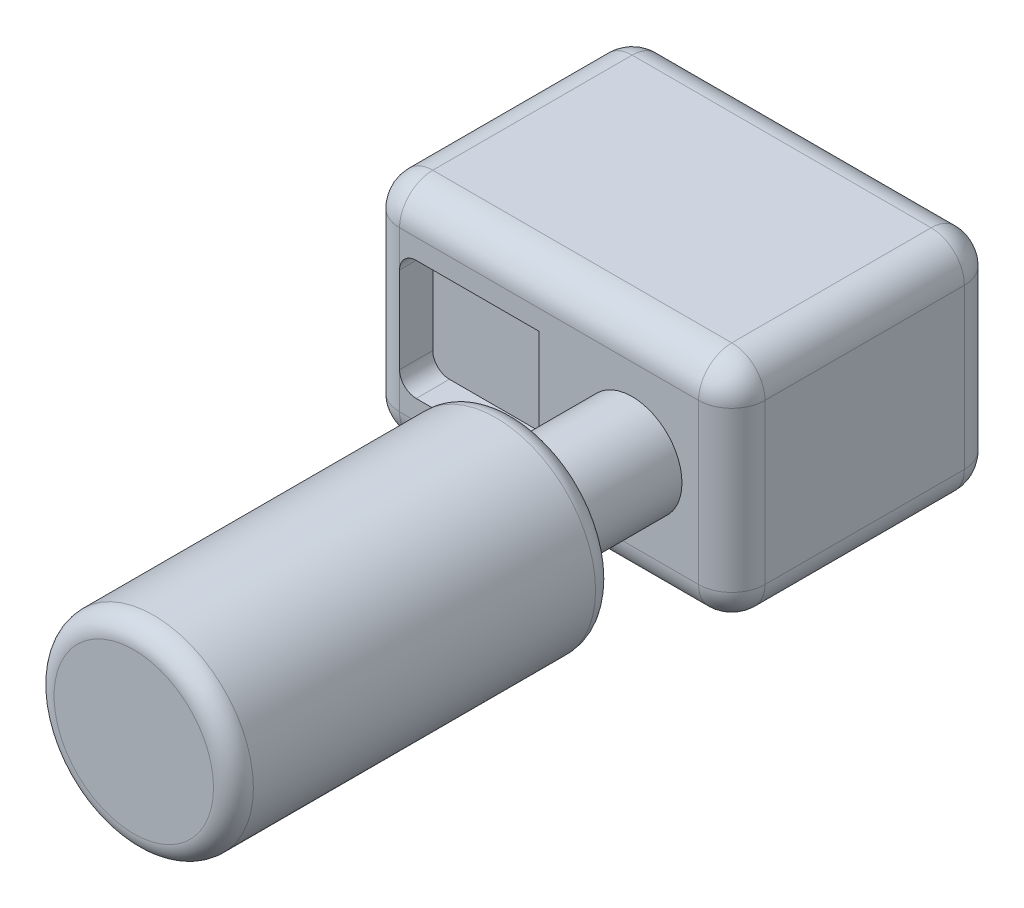
from build123d import *

# Parameters (mm, degrees)
ESQUISSE1_W             = 110
ESQUISSE1_H             = 68
BOSS_EXTRU_1_DEPTH      = 80
ESQUISSE2_R             = 30
BOSS_EXTRU_2_DEPTH      = 150
CONG_2_R                = 6
ESQUISSE8_R             = 30
ESQUISSE8_R_2           = 15
ENL_V_MAT_EXTRU_1_DEPTH = 35
CONG_3_R                = 6
CONG_4_R                = 10
CONG_5_R                = 10
ENL_V_MAT_EXTRU_2_DEPTH = 10


with BuildPart() as part:
    # Esquisse1 → Boss.-Extru.1 (new body)
    with BuildSketch(Plane.XY):
        with Locations((21.507469619, 14.274916944)):
            Rectangle(ESQUISSE1_W, ESQUISSE1_H)
    extrude(amount=BOSS_EXTRU_1_DEPTH)

    # Esquisse2 → Boss.-Extru.2 (add)
    with BuildSketch(Plane.XY.offset(80)):
        with Locations((46.507469619, 14.274916944)):
            Circle(ESQUISSE2_R)
    extrude(amount=BOSS_EXTRU_2_DEPTH)

    # Congé2
    cong_2_edges = [part.edges().sort_by_distance(p)[0] for p in [
        (16.507469619, 14.274916944, 230),
    ]]
    fillet(cong_2_edges, radius=CONG_2_R)

    # Esquisse8 → Enlèv. mat.-Extru.1 (cut)
    with BuildSketch(Plane.XY.offset(80)):
        with Locations((46.507469619, 14.274916944)):
            Circle(ESQUISSE8_R)
        with Locations((46.507469619, 14.274916944)):
            Circle(ESQUISSE8_R_2, mode=Mode.SUBTRACT)
    extrude(amount=ENL_V_MAT_EXTRU_1_DEPTH, mode=Mode.SUBTRACT)

    # Congé3
    cong_3_edges = [part.edges().sort_by_distance(p)[0] for p in [
        (16.507469619, 14.274916944, 115),
    ]]
    fillet(cong_3_edges, radius=CONG_3_R)

    # Congé4
    cong_4_edges = [part.edges().sort_by_distance(p)[0] for p in [
        (21.507469619, 48.274916944, 80),
        (-33.492530381, 14.274916944, 80),
        (21.507469619, 48.274916944, 0),
        (76.507469619, 14.274916944, 0),
        (21.507469619, -19.725083056, 0),
        (-33.492530381, 14.274916944, 0),
        (21.507469619, -19.725083056, 80),
        (-33.492530381, 48.274916944, 40),
        (76.507469619, 48.274916944, 40),
        (76.507469619, -19.725083056, 40),
        (-33.492530381, -19.725083056, 40),
    ]]
    fillet(cong_4_edges, radius=CONG_4_R)

    # Congé5
    # the kernel refuses this fillet: 10 mm, written as the material it takes off along each edge
    with BuildSketch(Plane(origin=(66.507469619, -9.725083056, 70), x_dir=(1, 0, 0), z_dir=(0, 0, 1))) as cong_5_piece_1_section:
        Polygon((0, 0), (CONG_5_R, 0), (CONG_5_R, -CONG_5_R), (0, -CONG_5_R), align=None)
    cong_5_piece_1 = extrude(amount=CONG_5_R, mode=Mode.PRIVATE)
    cong_5_piece_1 = cong_5_piece_1 - Plane(origin=(66.507469619, -9.725083056, 70), x_dir=(-0.7071067811865475, 0.7071067811865475, 0), z_dir=(0, 0, 1)) * Sphere(CONG_5_R, mode=Mode.PRIVATE)
    add(cong_5_piece_1, mode=Mode.SUBTRACT)
    with BuildSketch(Plane(origin=(66.507469619, 38.274916944, 70), x_dir=(1, 0, 0), z_dir=(0, 0, 1))) as cong_5_piece_2_section:
        Polygon((0, 0), (CONG_5_R, 0), (CONG_5_R, CONG_5_R), (0, CONG_5_R), align=None)
    cong_5_piece_2 = extrude(amount=CONG_5_R, mode=Mode.PRIVATE)
    cong_5_piece_2 = cong_5_piece_2 - Plane(origin=(66.507469619, 38.274916944, 70), x_dir=(-0.7071067811865475, -0.7071067811865475, 0), z_dir=(0, 0, 1)) * Sphere(CONG_5_R, mode=Mode.PRIVATE)
    add(cong_5_piece_2, mode=Mode.SUBTRACT)
    with BuildSketch(Plane(origin=(76.507469619, -9.725083056, 80), x_dir=(-1, 0, 0), z_dir=(0, 1, 0))) as cong_5_piece_3:
        with BuildLine():
            CenterArc((CONG_5_R, -CONG_5_R), CONG_5_R, 90, 90)
            Line((0, -CONG_5_R), (0, 0))
            Line((0, 0), (CONG_5_R, 0))
        make_face()
    extrude(amount=48, mode=Mode.SUBTRACT)

    # Esquisse9 → Enlèv. mat.-Extru.2 (cut)
    with BuildSketch(Plane.XY.offset(80)):
        with BuildLine():
            Line((-18.492530381, 32.274916944), (18.507469619, 32.274916944))
            Line((18.507469619, 32.274916944), (18.507469619, -3.725083056))
            Line((18.507469619, -3.725083056), (-18.492530381, -3.725083056))
            ThreePointArc((-18.492530381, -3.725083056), (-22.028064287, -2.260616962), (-23.492530381, 1.274916944))
            Line((-23.492530381, 1.274916944), (-23.492530381, 27.274916944))
            ThreePointArc((-23.492530381, 27.274916944), (-22.028064287, 30.810450849), (-18.492530381, 32.274916944))
        make_face()
    extrude(amount=-ENL_V_MAT_EXTRU_2_DEPTH, mode=Mode.SUBTRACT)


solid = part.part
